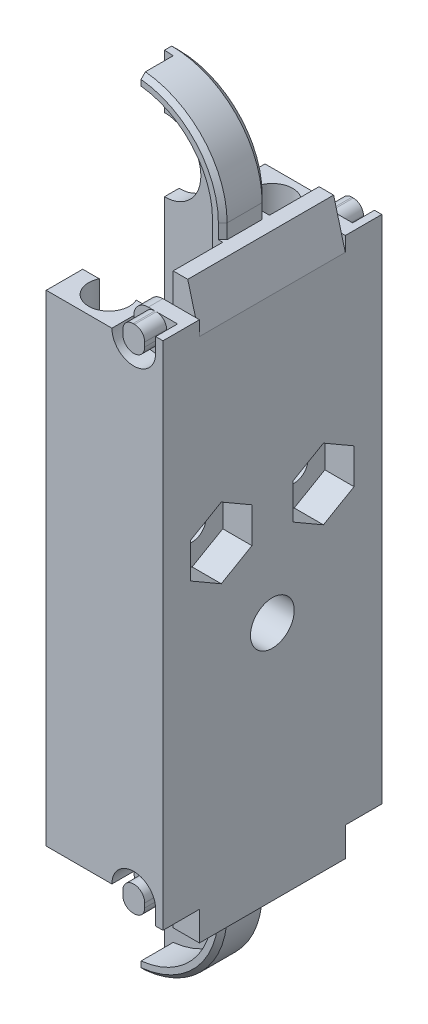
from build123d import *

# Parameters (mm, degrees)
SKETCH_1_R                  = 2.5
SKETCH_1_R_2                = 0.65
EXTRUDE_1_DEPTH             = 1
EXTRUDE_2_DEPTH             = 2.2
SKETCH_3_W                  = 1.2
SKETCH_3_H                  = 1.987567488
CUT_EXTRUDE_1_DEPTH         = 2.2
EXTRUDE_11_DEPTH            = 5.9
EXTRUDE_11_DEPTH_BACK       = 9.1
SKETCH_16_W                 = 2.5
SKETCH_16_H                 = 5
SKETCH_16_W_2               = 1.8
SKETCH_16_W_3               = 0.7
EXTRUDE_12_DEPTH            = 5.9
EXTRUDE_START               = -5.1
EXTRUDE_13_DEPTH            = 5.1
SKETCH_19_W                 = 2.5
SKETCH_19_H                 = 3.7
EXTRUDE_14_DEPTH            = 16
CUT_EXTRUDE_2_DEPTH         = 3.4
CUT_EXTRUDE_3_DEPTH         = 5
CUT_EXTRUDE_4_REACH         = 43.551
SKETCH_22_R                 = 0.65
EXTRUDE_15_DEPTH            = 2.6
CHAMFER_2_SIZE              = 5
CUT_EXTRUDE_5_DEPTH         = 5.9
CUT_EXTRUDE_6_REACH         = 43.758
SKETCH_28_W                 = 10
SKETCH_28_H                 = 1.75
CUT_EXTRUDE_7_DEPTH         = 2
SKETCH_29_R                 = 1.7
CUT_EXTRUDE_8_DEPTH         = 2
CUT_EXTRUDE_9_REACH         = 43.69
SKETCH_30_R                 = 0.95
CUT_EXTRUDE_10_DEPTH        = 2
CUT_EXTRUDE_11_DEPTH        = 44.426719885
SKETCH_33_W                 = 11
SKETCH_33_H                 = 23
CUT_EXTRUDE_12_DEPTH        = 5
SKETCH_34_R                 = 1.4
CUT_EXTRUDE_13_DEPTH        = 8
MIRROR_9_COPY_1_SKETCH_R    = 1.4
MIRROR_9_COPY_1_DEPTH       = 8
CUT_EXTRUDE_14_REACH        = 42.076
SKETCH_35_R                 = 1.5
EXTRUDE_16_DEPTH            = 2.5
EXTRUDE_17_REACH            = 44.628
EXTRUDE_18_DEPTH            = 2.5
SKETCH_40_W                 = 10
SKETCH_40_H                 = 3
EXTRUDE_19_DEPTH            = 1.8
CHAMFER_3_SIZE              = 3
SKETCH_41_W                 = 6.357317945
SKETCH_41_H                 = 3.539642379
SKETCH_41_W_2               = 6.079654968
SKETCH_41_H_2               = 5.540245973
CUT_EXTRUDE_15_DEPTH        = 3
SKETCH_42_W                 = 7.069931905
SKETCH_42_H                 = 2.882416327
SKETCH_42_W_2               = 5.4803832
SKETCH_42_H_2               = 3.970961981
CUT_EXTRUDE_16_DEPTH        = 3
SKETCH_43_R                 = 1.5
SKETCH_43_R_2               = 0.75
CUT_EXTRUDE_17_DEPTH        = 1.5
MIRROR_13_COPY_1_SKETCH_R   = 1.5
MIRROR_13_COPY_1_SKETCH_R_2 = 0.75
MIRROR_13_COPY_1_DEPTH      = 1.5
CHAMFER_4_SIZE              = 0.3
CHAMFER_5_SIZE              = 0.5
CHAMFER_6_SIZE              = 0.3
CHAMFER_7_SIZE              = 0.5
EXTRUDE_20_DEPTH            = 1
EXTRUDE_21_DEPTH            = 1
FILLET_2_R                  = 0.7
FILLET_3_R                  = 1
CHAMFER_8_SIZE              = 1


# Some blends are built 0.0001 mm under size
with BuildPart() as part:
    # 草图1 → 凸台-拉伸1 (new body)
    with BuildSketch(Plane.XY):
        with BuildLine():
            Line((0, 0), (12.4, 0))
            Line((12.4, 0), (12.4, 9))
            ThreePointArc((12.4, 9), (6.2, 15.2), (0, 9))
            Line((0, 9), (0, 0))
        make_face()
        with Locations((6.2, 9)):
            Circle(SKETCH_1_R, mode=Mode.SUBTRACT)
        with Locations((1.95, 3.5)):
            Circle(SKETCH_1_R_2, mode=Mode.SUBTRACT)
        with Locations((10.45, 3.5)):
            Circle(SKETCH_1_R_2, mode=Mode.SUBTRACT)
    extrude_1 = extrude(amount=EXTRUDE_1_DEPTH)

    # 草图2 → 凸台-拉伸2 (add)
    with BuildSketch(Plane.XY.offset(1)):
        with BuildLine():
            Line((0.7, 0), (0.7, 9))
            ThreePointArc((0.7, 9), (6.2, 14.5), (11.7, 9))
            Line((11.7, 9), (11.7, 0))
            Line((11.7, 0), (12.4, 0))
            Line((12.4, 0), (12.4, 9))
            ThreePointArc((12.4, 9), (6.2, 15.2), (0, 9))
            Line((0, 9), (0, 0))
            Line((0, 0), (0.7, 0))
        make_face()
    extrude_2 = extrude(amount=EXTRUDE_2_DEPTH)

    # 草图3 → 切除-拉伸1 (cut)
    with BuildSketch(Plane.XY.offset(3.2)):
        with Locations((6.2, 14.672998783)):
            Rectangle(SKETCH_3_W, SKETCH_3_H)
    cut_extrude_1 = extrude(amount=-CUT_EXTRUDE_1_DEPTH, mode=Mode.SUBTRACT)

    # 草图16 → 凸台-拉伸11 (add, two sides: drawn at the far end of the back side and taken through both)
    with BuildSketch(Plane.XY.offset(3.2).offset(-EXTRUDE_11_DEPTH_BACK)):
        Polygon((14.2, -28), (14.2, 0), (12.4, 0), (11.7, 0), (0.7, 0), (-1.8, 0), (-1.8, -28), align=None)
        with Locations((-0.55, 2.5)):
            Rectangle(SKETCH_16_W, SKETCH_16_H)
        with Locations((13.3, 2.5)):
            Rectangle(SKETCH_16_W_2, SKETCH_16_H)
        with Locations((12.05, 2.5)):
            Rectangle(SKETCH_16_W_3, SKETCH_16_H)
    extrude(amount=EXTRUDE_11_DEPTH + EXTRUDE_11_DEPTH_BACK)

    # 草图17 → 凸台-拉伸12 (add)
    with BuildSketch(Plane(origin=(0, 0, -5.9), x_dir=(-1, 0, 0), z_dir=(0, 0, -1))):
        with BuildLine():
            ThreePointArc((-0.7, 3.611122566), (-6.2, 1.3), (-11.7, 3.611122566))
            Line((-11.7, 3.611122566), (-11.7, 0))
            Line((-11.7, 0), (-0.7, 0))
            Line((-0.7, 0), (-0.7, 3.611122566))
        make_face()
    extrude_12 = extrude(amount=-EXTRUDE_12_DEPTH)

    # 草图18 → 凸台-拉伸13 (add)
    with BuildSketch(Plane.XY.offset(9.1).offset(EXTRUDE_START)):
        with BuildLine():
            Line((11.7, 0), (11.7, 3.611122566))
            ThreePointArc((11.7, 3.611122566), (6.2, 1.3), (0.7, 3.611122566))
            Line((0.7, 3.611122566), (0.7, 0))
            Line((0.7, 0), (11.7, 0))
        make_face()
    extrude_13 = extrude(amount=EXTRUDE_13_DEPTH)

    # 草图19 → 凸台-拉伸14 (add)
    with BuildSketch(Plane.ZY.offset(1.8)):
        with Locations((7.85, 3.15)):
            Rectangle(SKETCH_19_W, SKETCH_19_H)
        Polygon((-3.4, 5), (-5.9, 5), (-5.9, 3.611122566), (-5.9, 1.3), (-3.4, 1.3), align=None)
    extrude_14 = extrude(amount=-EXTRUDE_14_DEPTH)

    # 镜向1: 凸台-拉伸1, 凸台-拉伸2, 切除-拉伸1, 凸台-拉伸12, 凸台-拉伸13, 凸台-拉伸14 across plane
    add(extrude_1.mirror(Plane.ZX.offset(-11.5)))
    add(extrude_2.mirror(Plane.ZX.offset(-11.5)))
    add(cut_extrude_1.mirror(Plane.ZX.offset(-11.5)), mode=Mode.SUBTRACT)
    add(extrude_12.mirror(Plane.ZX.offset(-11.5)))
    add(extrude_13.mirror(Plane.ZX.offset(-11.5)))
    add(extrude_14.mirror(Plane.ZX.offset(-11.5)))

    # 草图20 → 切除-拉伸2 (cut)
    with BuildSketch(Plane(origin=(0, 0, 0), x_dir=(-1, 0, 0), z_dir=(0, 0, -1))):
        with BuildLine():
            Line((-12.4, -28), (-12.77951366, -28))
            ThreePointArc((-12.77951366, -28), (-8.276986377, -39.414588835), (1.5, -32))
            ThreePointArc((1.5, -32), (1.214588835, -29.923013623), (0.37951366, -28))
            Line((0.37951366, -28), (0, -28))
            Line((0, -28), (-0.35, -28))
            Line((-0.35, -28), (-1.526305235, -28))
            Line((-1.526305235, -28), (-6.2, -32))
            Line((-6.2, -32), (-10.873694765, -28))
            Line((-10.873694765, -28), (-12.05, -28))
            Line((-12.05, -28), (-12.4, -28))
        make_face()
        with BuildLine():
            ThreePointArc((-0.35, -26.99325455), (-6.2, -24.3), (-12.05, -26.99325455))
            Line((-12.05, -26.99325455), (-10.873694765, -28))
            Line((-10.873694765, -28), (-1.526305235, -28))
            Line((-1.526305235, -28), (-0.35, -26.99325455))
        make_face()
        Polygon((-0.35, -28), (-0.35, -26.99325455), (-1.526305235, -28), align=None)
        Polygon((-10.873694765, -28), (-12.05, -26.99325455), (-12.05, -28), align=None)
    extrude(amount=CUT_EXTRUDE_2_DEPTH, mode=Mode.SUBTRACT)

    # 草图21 → 切除-拉伸3 (cut)
    with BuildSketch(Plane.XZ.offset(28)):
        Polygon((11.7, 1), (11.7, 3.2), (11.7, 6.6), (0.7, 6.6), (0.7, 3.2), (0.7, 1), align=None)
    extrude(amount=-CUT_EXTRUDE_3_DEPTH, mode=Mode.SUBTRACT)

    # 草图22 → 切除-拉伸4 (cut, up to next)
    with BuildSketch(Plane.XY.offset(1), mode=Mode.PRIVATE) as cut_extrude_4_sk1:
        with Locations((1.95, -26.5)):
            Circle(SKETCH_22_R)
    cut_extrude_4_tool1 = extrude(cut_extrude_4_sk1.sketch, amount=-CUT_EXTRUDE_4_REACH, mode=Mode.PRIVATE) & part.part
    # 草图22 → 切除-拉伸4 (cut, up to next)
    with BuildSketch(Plane.XY.offset(1), mode=Mode.PRIVATE) as cut_extrude_4_sk2:
        with Locations((10.45, -26.5)):
            Circle(SKETCH_22_R)
    cut_extrude_4_tool2 = extrude(cut_extrude_4_sk2.sketch, amount=-CUT_EXTRUDE_4_REACH, mode=Mode.PRIVATE) & part.part
    add(cut_extrude_4_tool1.solids().sort_by_distance((1.95, -26.5, 1))[0], mode=Mode.SUBTRACT)
    add(cut_extrude_4_tool2.solids().sort_by_distance((10.45, -26.5, 1))[0], mode=Mode.SUBTRACT)

    # 草图23 → 凸台-拉伸15 (add)
    with BuildSketch(Plane(origin=(0, 0, 6.6), x_dir=(-1, 0, 0), z_dir=(0, 0, -1))):
        with BuildLine():
            Line((-11.7, -23), (-11.7, -26.611122566))
            ThreePointArc((-11.7, -26.611122566), (-6.2, -24.3), (-0.7, -26.611122566))
            Line((-0.7, -26.611122566), (-0.7, -23))
            Line((-0.7, -23), (-11.7, -23))
        make_face()
    extrude(amount=EXTRUDE_15_DEPTH)

    # 倒角2
    # the kernel refuses this chamfer: 5 mm, written as the material it takes off along each edge
    with BuildSketch(Plane(origin=(-1.8, 5, -18.75841494), x_dir=(0.9996219169112968, 0.027495876610586317, 0), z_dir=(0, 0, 1))) as chamfer_2_piece_1_section:
        Polygon((CHAMFER_2_SIZE * 0.999621916911, -CHAMFER_2_SIZE * 0.0274958766106), (-CHAMFER_2_SIZE * 0.0274958766106, -CHAMFER_2_SIZE * 0.999621916911), (0, 0), align=None)
    chamfer_2_piece_1 = extrude(amount=40.71682988, mode=Mode.PRIVATE)
    chamfer_2_piece_1 = split(chamfer_2_piece_1, bisect_by=Plane(origin=(1.590796198, 4.388381622, 0), z_dir=(0, 0, -1)), keep=Keep.TOP, mode=Mode.PRIVATE)
    add(chamfer_2_piece_1, mode=Mode.SUBTRACT)
    with BuildSketch(Plane(origin=(-1.8, 5, -18.75841494), x_dir=(0.9996219169112968, 0.027495876610586317, 0), z_dir=(0, 0, 1))) as chamfer_2_piece_2_section:
        Polygon((CHAMFER_2_SIZE * 0.999621916911, -CHAMFER_2_SIZE * 0.0274958766106), (-CHAMFER_2_SIZE * 0.0274958766106, -CHAMFER_2_SIZE * 0.999621916911), (0, 0), align=None)
    chamfer_2_piece_2 = extrude(amount=40.71682988, mode=Mode.PRIVATE)
    chamfer_2_piece_2 = split(chamfer_2_piece_2, bisect_by=Plane(origin=(0, 4.808302605, 0.5), z_dir=(-1, 0, 0)), keep=Keep.TOP, mode=Mode.PRIVATE)
    add(chamfer_2_piece_2, mode=Mode.SUBTRACT)
    with BuildSketch(Plane(origin=(-1.8, 5, -18.75841494), x_dir=(0.9996219169112968, 0.027495876610586317, 0), z_dir=(0, 0, 1))) as chamfer_2_piece_3_section:
        Polygon((CHAMFER_2_SIZE * 0.999621916911, -CHAMFER_2_SIZE * 0.0274958766106), (-CHAMFER_2_SIZE * 0.0274958766106, -CHAMFER_2_SIZE * 0.999621916911), (0, 0), align=None)
    chamfer_2_piece_3 = extrude(amount=40.71682988, mode=Mode.PRIVATE)
    chamfer_2_piece_3 = split(chamfer_2_piece_3, bisect_by=Plane(origin=(0.39801984, 4.473287655, 3.2), z_dir=(0, 0, 1)), keep=Keep.TOP, mode=Mode.PRIVATE)
    add(chamfer_2_piece_3, mode=Mode.SUBTRACT)

    # 草图26 → 切除-拉伸5 (cut)
    with BuildSketch(Plane(origin=(0, 0, -5.9), x_dir=(-1, 0, 0), z_dir=(0, 0, -1))):
        Polygon((1.8, -28), (1.8, -23), (-3.2, -28), align=None)
    cut_extrude_5 = extrude(amount=-CUT_EXTRUDE_5_DEPTH, mode=Mode.SUBTRACT)

    # 镜向2: 切除-拉伸5 across plane
    add(cut_extrude_5.mirror(Plane(origin=(0, 0, 1.6), x_dir=(1, 0, 0), z_dir=(0, 0, -1))), mode=Mode.SUBTRACT)

    # 草图27 → 切除-拉伸6 (cut, up to next)
    with BuildSketch(Plane(origin=(0, 0, 0), x_dir=(-1, 0, 0), z_dir=(0, 0, -1)), mode=Mode.PRIVATE) as cut_extrude_6_sk1:
        Polygon((0, -28), (-1.278284404, -26.078284404), (1.8, -23), (1.8, -28), align=None)
    cut_extrude_6_tool1 = extrude(cut_extrude_6_sk1.sketch, amount=-CUT_EXTRUDE_6_REACH, mode=Mode.PRIVATE) & part.part
    add(cut_extrude_6_tool1.solids().sort_by_distance((-0.663805, -25.998597, 0))[0], mode=Mode.SUBTRACT)

    # 草图28 → 切除-拉伸7 (cut)
    with BuildSketch(Plane.ZY.offset(1.8)):
        with Locations((1.6, -23.875)):
            Rectangle(SKETCH_28_W, SKETCH_28_H)
        with Locations((1.6, -22.125)):
            Rectangle(SKETCH_28_W, SKETCH_28_H)
    extrude(amount=-CUT_EXTRUDE_7_DEPTH, mode=Mode.SUBTRACT)

    # 草图29 → 切除-拉伸8 (cut)
    with BuildSketch(Plane.ZY.offset(1.8)):
        with Locations(Location((5.1, -8, 0), (0, 0, 270))):
            Circle(SKETCH_29_R)
        with Locations(Location((-1.9, -8, 0), (0, 0, 90))):
            Circle(SKETCH_29_R)
    extrude(amount=-CUT_EXTRUDE_8_DEPTH, mode=Mode.SUBTRACT)

    # 草图30 → 切除-拉伸9 (cut, up to next)
    with BuildSketch(Plane.ZY.offset(-0.2), mode=Mode.PRIVATE) as cut_extrude_9_sk1:
        with Locations(Location((5.1, -8, 0), (0, 0, 270))):
            Circle(SKETCH_30_R)
    cut_extrude_9_tool1 = extrude(cut_extrude_9_sk1.sketch, amount=-CUT_EXTRUDE_9_REACH, mode=Mode.PRIVATE) & part.part
    # 草图30 → 切除-拉伸9 (cut, up to next)
    with BuildSketch(Plane.ZY.offset(-0.2), mode=Mode.PRIVATE) as cut_extrude_9_sk2:
        with Locations(Location((-1.9, -8, 0), (0, 0, 270))):
            Circle(SKETCH_30_R)
    cut_extrude_9_tool2 = extrude(cut_extrude_9_sk2.sketch, amount=-CUT_EXTRUDE_9_REACH, mode=Mode.PRIVATE) & part.part
    add(cut_extrude_9_tool1.solids().sort_by_distance((0.2, -8, 5.1))[0], mode=Mode.SUBTRACT)
    add(cut_extrude_9_tool2.solids().sort_by_distance((0.2, -8, -1.9))[0], mode=Mode.SUBTRACT)

    # 草图31 → 切除-拉伸10 (cut)
    with BuildSketch(Plane(origin=(14.2, 0, 0), x_dir=(0, 0, -1), z_dir=(1, 0, 0))):
        Polygon((1.9, -10.424871131), (4, -9.212435565), (4, -6.787564435), (1.9, -5.575128869), (-0.2, -6.787564435), (-0.2, -9.212435565), align=None)
        Polygon((-5.1, -10.424871131), (-3, -9.212435565), (-3, -6.787564435), (-5.1, -5.575128869), (-7.2, -6.787564435), (-7.2, -9.212435565), align=None)
    extrude(amount=-CUT_EXTRUDE_10_DEPTH, mode=Mode.SUBTRACT)

    # 草图32 → 切除-拉伸11 (cut, through all)
    with BuildSketch(Plane.XY.offset(9.1)):
        Polygon((-1.8, -23), (-1.8, -11.5), (-1.8, 0), (3.2, 5), (6.2, 5), (6.2, 21.039752346), (-6.699742721, 21.039752346), (-6.699742721, -44.039752346), (6.2, -44.039752346), (6.2, -28), (3.2, -28), align=None)
        Polygon((-1.8, 0), (-1.8, -11.5), (6.2, -11.5), (6.2, 5), (3.2, 5), align=None)
        Polygon((6.2, -11.5), (-1.8, -11.5), (-1.8, -23), (3.2, -28), (6.2, -28), align=None)
    extrude(amount=-CUT_EXTRUDE_11_DEPTH, mode=Mode.SUBTRACT)

    # 草图33 → 切除-拉伸12 (cut)
    with BuildSketch(Plane.ZY.offset(-6.2)):
        with Locations((1.6, -11.5)):
            Rectangle(SKETCH_33_W, SKETCH_33_H)
    extrude(amount=-CUT_EXTRUDE_12_DEPTH, mode=Mode.SUBTRACT)

    # 草图34 → 切除-拉伸13 (cut)
    with BuildSketch(Plane(origin=(0, 5, 0), x_dir=(1, 0, 0), z_dir=(0, 1, 0))):
        with Locations(Location((8.6, -7.2, 0), (0, 0, 175.903956242))):
            Circle(SKETCH_34_R)
    cut_extrude_13 = extrude(amount=-CUT_EXTRUDE_13_DEPTH, mode=Mode.SUBTRACT)

    # 镜向8: 切除-拉伸13 across plane
    add(cut_extrude_13.mirror(Plane(origin=(0, -11.5, 0), x_dir=(0, 0, 1), z_dir=(0, -1, 0))), mode=Mode.SUBTRACT)

    # 镜向9: 切除-拉伸13 across plane
    add(cut_extrude_13.mirror(Plane(origin=(0, 0, 1.6), x_dir=(1, 0, 0), z_dir=(0, 0, -1))), mode=Mode.SUBTRACT)

    # 镜向9 copy 1 sketch → 镜向9 copy 1 (cut)
    with BuildSketch(Plane(origin=(0, -28, 3.2), x_dir=(1, 0, 0), z_dir=(0, -1, 0))):
        with Locations(Location((8.6, -7.2, 0), (0, 0, 175.903956242))):
            Circle(MIRROR_9_COPY_1_SKETCH_R)
    extrude(amount=-MIRROR_9_COPY_1_DEPTH, mode=Mode.SUBTRACT)

    # 草图35 → 切除-拉伸14 (cut, up to next)
    with BuildSketch(Plane(origin=(14.2, 0, 0), x_dir=(0, 0, -1), z_dir=(1, 0, 0)), mode=Mode.PRIVATE) as cut_extrude_14_sk1:
        with Locations(Location((-1.6, -14.5, 0), (0, 0, 90))):
            Circle(SKETCH_35_R)
    cut_extrude_14_tool1 = extrude(cut_extrude_14_sk1.sketch, amount=-CUT_EXTRUDE_14_REACH, mode=Mode.PRIVATE) & part.part
    add(cut_extrude_14_tool1.solids().sort_by_distance((14.2, -14.5, 1.6))[0], mode=Mode.SUBTRACT)

    # 草图36 → 凸台-拉伸16 (add)
    with BuildSketch(Plane.XY.offset(9.1)):
        Polygon((14.2, 5), (13.4, 8), (12.4, 8), (10.2, 5), align=None)
    extrude_16 = extrude(amount=-EXTRUDE_16_DEPTH)

    # 镜向10: 凸台-拉伸16 across plane
    add(extrude_16.mirror(Plane.XY.offset(1.6)))

    # 草图37 → 凸台-拉伸17 (add, up to next)
    with BuildSketch(Plane(origin=(0, 0, 6.6), x_dir=(-1, 0, 0), z_dir=(0, 0, -1)), mode=Mode.PRIVATE) as extrude_17_sk1:
        Polygon((-13.4, 5), (-14.2, 5), (-13.4, 8), (-12.4, 8), (-12.4, 5), align=None)
    extrude_17_tool1 = extrude(extrude_17_sk1.sketch, amount=EXTRUDE_17_REACH, mode=Mode.PRIVATE) - part.part
    add(extrude_17_tool1.solids().sort_by_distance((13.119048, 6.357143, 6.6))[0])

    # 草图38 → 凸台-拉伸18 (add)
    with BuildSketch(Plane.XY.offset(9.1)):
        Polygon((12.4, -28), (14.2, -28), (14.2, -31), (12.4, -31), (10.2, -28), align=None)
    extrude_18 = extrude(amount=-EXTRUDE_18_DEPTH)

    # 镜向11: 凸台-拉伸18 across plane
    add(extrude_18.mirror(Plane.XY.offset(1.6)))

    # 草图40 → 凸台-拉伸19 (add)
    with BuildSketch(Plane(origin=(14.2, 0, 0), x_dir=(0, 0, -1), z_dir=(1, 0, 0))):
        with Locations((-1.6, -29.5)):
            Rectangle(SKETCH_40_W, SKETCH_40_H)
    extrude(amount=-EXTRUDE_19_DEPTH)

    # 倒角3
    # the kernel refuses this chamfer: 3 mm, written as the material it takes off along each edge
    with BuildSketch(Plane(origin=(17.711472968, -3, 7.1), x_dir=(0, -0.9996219169112969, -0.02749587661058649), z_dir=(-1, 0, 0))) as chamfer_3_piece_1_section:
        Polygon((CHAMFER_3_SIZE * 0.999621916911, CHAMFER_3_SIZE * 0.0274958766106), (-CHAMFER_3_SIZE * 0.0274958766106, CHAMFER_3_SIZE * 0.999621916911), (0, 0), align=None)
    chamfer_3_piece_1 = extrude(amount=18.222945937, mode=Mode.PRIVATE)
    chamfer_3_piece_1 = chamfer_3_piece_1 & Plane(origin=(8.6, -4.213072863, 7.2), x_dir=(-0.9974457174122572, 0, -0.07142857142591957), z_dir=(0, 1, 0)) * Cylinder(1.4, 49, mode=Mode.PRIVATE)
    add(chamfer_3_piece_1, mode=Mode.SUBTRACT)
    with BuildSketch(Plane(origin=(17.711472968, -20, 7.1), x_dir=(0, -0.02749587661058678, 0.9996219169112968), z_dir=(-1, 0, 0))) as chamfer_3_piece_2_section:
        Polygon((CHAMFER_3_SIZE * 0.999621916911, CHAMFER_3_SIZE * 0.0274958766106), (-CHAMFER_3_SIZE * 0.0274958766106, CHAMFER_3_SIZE * 0.999621916911), (0, 0), align=None)
    chamfer_3_piece_2 = extrude(amount=18.222945937, mode=Mode.PRIVATE)
    chamfer_3_piece_2 = chamfer_3_piece_2 & Plane(origin=(8.6, -18.786927137, 7.2), x_dir=(-0.9974457174122572, 0, -0.07142857142591957), z_dir=(0, -1, 0)) * Cylinder(1.4, 49, mode=Mode.PRIVATE)
    add(chamfer_3_piece_2, mode=Mode.SUBTRACT)
    with BuildSketch(Plane(origin=(17.711472968, -20, -3.9), x_dir=(0, 0.9996219169112968, 0.027495876610586046), z_dir=(-1, 0, 0))) as chamfer_3_piece_3_section:
        Polygon((CHAMFER_3_SIZE * 0.999621916911, CHAMFER_3_SIZE * 0.0274958766106), (-CHAMFER_3_SIZE * 0.0274958766106, CHAMFER_3_SIZE * 0.999621916911), (0, 0), align=None)
    chamfer_3_piece_3 = extrude(amount=18.222945937, mode=Mode.PRIVATE)
    chamfer_3_piece_3 = chamfer_3_piece_3 & Plane(origin=(8.6, -18.786927137, -4), x_dir=(-0.9974457174122572, 0, 0.07142857142591957), z_dir=(0, -1, 0)) * Cylinder(1.4, 49, mode=Mode.PRIVATE)
    add(chamfer_3_piece_3, mode=Mode.SUBTRACT)
    with BuildSketch(Plane(origin=(17.711472968, -3, -3.9), x_dir=(0, 0.02749587661058634, -0.9996219169112968), z_dir=(-1, 0, 0))) as chamfer_3_piece_4_section:
        Polygon((CHAMFER_3_SIZE * 0.999621916911, CHAMFER_3_SIZE * 0.0274958766106), (-CHAMFER_3_SIZE * 0.0274958766106, CHAMFER_3_SIZE * 0.999621916911), (0, 0), align=None)
    chamfer_3_piece_4 = extrude(amount=18.222945937, mode=Mode.PRIVATE)
    chamfer_3_piece_4 = chamfer_3_piece_4 & Plane(origin=(8.6, -4.213072863, -4), x_dir=(-0.9974457174122572, 0, 0.07142857142591957), z_dir=(0, 1, 0)) * Cylinder(1.4, 49, mode=Mode.PRIVATE)
    add(chamfer_3_piece_4, mode=Mode.SUBTRACT)

    # 草图41 → 切除-拉伸15 (cut)
    with BuildSketch(Plane.XZ.offset(28)):
        with Locations((13.378658973, -5.16982119)):
            Rectangle(SKETCH_41_W, SKETCH_41_H)
        with Locations((13.239827484, 9.370122987)):
            Rectangle(SKETCH_41_W_2, SKETCH_41_H_2)
    extrude(amount=CUT_EXTRUDE_15_DEPTH, mode=Mode.SUBTRACT)

    # 草图42 → 切除-拉伸16 (cut)
    with BuildSketch(Plane(origin=(0, 5, 0), x_dir=(1, 0, 0), z_dir=(0, 1, 0))):
        with Locations((13.734965953, 4.841208164)):
            Rectangle(SKETCH_42_W, SKETCH_42_H)
        with Locations((12.9401916, -8.585480991)):
            Rectangle(SKETCH_42_W_2, SKETCH_42_H_2)
    extrude(amount=CUT_EXTRUDE_16_DEPTH, mode=Mode.SUBTRACT)

    # 草图43 → 切除-拉伸17 (cut)
    with BuildSketch(Plane.XY.offset(9.1)):
        with Locations((12.2, 5)):
            Circle(SKETCH_43_R)
        with Locations((12.2, 5)):
            Circle(SKETCH_43_R_2, mode=Mode.SUBTRACT)
    cut_extrude_17 = extrude(amount=-CUT_EXTRUDE_17_DEPTH, mode=Mode.SUBTRACT)

    # 镜向12: 切除-拉伸17 across plane
    add(cut_extrude_17.mirror(Plane(origin=(0, 0, 1.6), x_dir=(1, 0, 0), z_dir=(0, 0, -1))), mode=Mode.SUBTRACT)

    # 镜向13: 切除-拉伸17 across plane
    add(cut_extrude_17.mirror(Plane(origin=(0, -11.5, 0), x_dir=(0, 0, 1), z_dir=(0, -1, 0))), mode=Mode.SUBTRACT)

    # 镜向13 copy 1 sketch → 镜向13 copy 1 (cut)
    with BuildSketch(Plane(origin=(0, -23, -5.9), x_dir=(1, 0, 0), z_dir=(0, 0, -1))):
        with Locations((12.2, 5)):
            Circle(MIRROR_13_COPY_1_SKETCH_R)
        with Locations((12.2, 5)):
            Circle(MIRROR_13_COPY_1_SKETCH_R_2, mode=Mode.SUBTRACT)
    extrude(amount=-MIRROR_13_COPY_1_DEPTH, mode=Mode.SUBTRACT)

    # 倒角4
    chamfer_4_edges = [part.edges().sort_by_distance(p)[0] for p in [
        (10.791296113, 13.166533331, 3.2),
        (12.4, 8.5, 3.2),
    ]]
    chamfer(chamfer_4_edges, length=CHAMFER_4_SIZE)

    # 倒角5
    chamfer_5_edges = [part.edges().sort_by_distance(p)[0] for p in [
        (10.584062043, 13.384062043, 0),
        (12.4, 8.5, 0),
    ]]
    chamfer(chamfer_5_edges, length=CHAMFER_5_SIZE)

    # 倒角6
    chamfer_6_edges = [part.edges().sort_by_distance(p)[0] for p in [
        (10.791296113, -36.166533331, 3.2),
        (12.4, -31.5, 3.2),
    ]]
    chamfer(chamfer_6_edges, length=CHAMFER_6_SIZE)

    # 倒角7
    chamfer_7_edges = [part.edges().sort_by_distance(p)[0] for p in [
        (10.584062043, -36.384062043, 0),
        (12.4, -31.5, 0),
    ]]
    chamfer(chamfer_7_edges, length=CHAMFER_7_SIZE)

    # 草图44 → 凸台-拉伸20 (add)
    with BuildSketch(Plane(origin=(0, 5, 0), x_dir=(1, 0, 0), z_dir=(0, 1, 0))):
        Polygon((10.7, -6.6), (10.7, -7.6), (11.45, -7.6), (11.45, -9.1), (12.95, -9.1), (12.95, -7.6), (13.7, -7.6), (13.7, -9.1), (14.2, -9.1), (14.2, -6.6), (12.4, -6.6), (11.7, -6.6), align=None)
        Polygon((11.45, 4.4), (10.7, 4.4), (10.7, 3.4), (11.7, 3.4), (12.4, 3.4), (14.2, 3.4), (14.2, 5.9), (13.7, 5.9), (13.7, 4.4), (12.95, 4.4), (12.95, 5.9), (11.45, 5.9), align=None)
    extrude(amount=EXTRUDE_20_DEPTH)

    # 草图45 → 凸台-拉伸21 (add)
    with BuildSketch(Plane.XZ.offset(28)):
        Polygon((12.4, -3.4), (12.05, -3.4), (10.7, -3.4), (10.7, -4.4), (11.45, -4.4), (11.45, -5.9), (12.95, -5.9), (12.95, -4.4), (13.7, -4.4), (13.7, -5.9), (14.2, -5.9), (14.2, -3.4), align=None)
        Polygon((11.45, 7.6), (10.7, 7.6), (10.7, 6.6), (11.7, 6.6), (12.4, 6.6), (14.2, 6.6), (14.2, 9.1), (13.7, 9.1), (13.7, 7.6), (12.95, 7.6), (12.95, 9.1), (11.45, 9.1), align=None)
    extrude(amount=EXTRUDE_21_DEPTH)

    # 圆角2
    fillet_2_edges = [part.edges().sort_by_distance(p)[0] for p in [
        (11.45, 6, 8.35),
        (12.95, 6, 8.35),
        (12.95, 6, -5.15),
        (11.45, 6, -5.15),
        (11.45, -29, -5.15),
        (12.95, -29, -5.15),
        (12.95, -29, 8.35),
        (11.45, -29, 8.35),
    ]]
    fillet(fillet_2_edges, radius=FILLET_2_R)

    # 圆角3
    fillet_3_edges = [part.edges().sort_by_distance(p)[0] for p in [
        (10.7, -29, 7.1),
        (10.7, -29, -3.9),
        (10.7, 6, 7.1),
        (10.7, 6, -3.9),
    ]]
    fillet(fillet_3_edges, radius=FILLET_3_R - 0.0001)  # a hair under: the kernel refuses the full size

    # 倒角8
    chamfer_8_edges = [part.edges().sort_by_distance(p)[0] for p in [
        (12.4, -31, 1.7),
    ]]
    chamfer(chamfer_8_edges, length=CHAMFER_8_SIZE - 0.0001)  # a hair under: the kernel refuses the full size


solid = part.part
